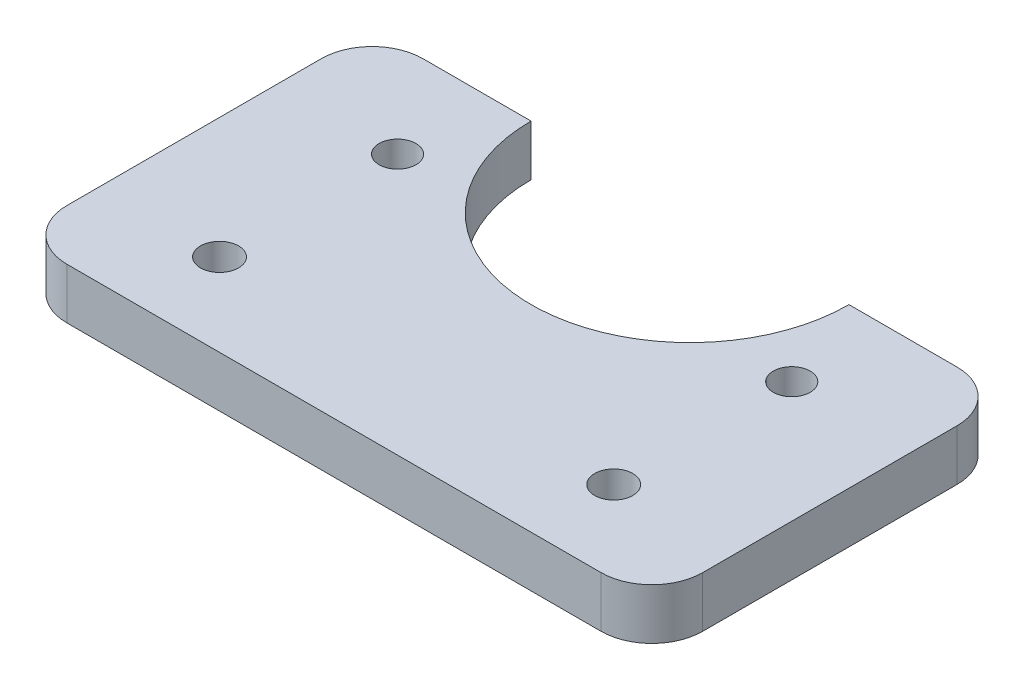
from build123d import *

# Parameters (mm, degrees)
SKETCH_1_W          = 50
SKETCH_1_H          = 25
EXTRUDE_1_DEPTH     = 4
SKETCH_2_R          = 1.45
CUT_EXTRUDE_1_DEPTH = 4
SKETCH_3_R          = 12.5
CUT_EXTRUDE_2_DEPTH = 4
SKETCH_5_W          = 50
SKETCH_5_H          = 4
EXTRUDE_2_DEPTH     = 3
FILLET_1_R          = 4
SKETCH_11_R         = 1.5
CUT_EXTRUDE_4_DEPTH = 10


with BuildPart() as part:
    # 草图1 → 凸台-拉伸1 (new body)
    with BuildSketch(Plane(origin=(0, 0, 0), x_dir=(1, 0, 0), z_dir=(0, 1, 0))):
        Rectangle(SKETCH_1_W, SKETCH_1_H)
    extrude(amount=EXTRUDE_1_DEPTH)

    # 草图2 → 切除-拉伸1 (cut)
    with BuildSketch(Plane(origin=(0, 4, 0), x_dir=(1, 0, 0), z_dir=(0, 1, 0))):
        with Locations((-15.5, 5)):
            Circle(SKETCH_2_R)
        with Locations((15.5, 5)):
            Circle(SKETCH_2_R)
    extrude(amount=-CUT_EXTRUDE_1_DEPTH, mode=Mode.SUBTRACT)

    # 草图3 → 切除-拉伸2 (cut)
    with BuildSketch(Plane(origin=(0, 4, 0), x_dir=(1, 0, 0), z_dir=(0, 1, 0))):
        with Locations((0, 12.5)):
            Circle(SKETCH_3_R)
    extrude(amount=-CUT_EXTRUDE_2_DEPTH, mode=Mode.SUBTRACT)

    # 草图5 → 凸台-拉伸2 (add)
    with BuildSketch(Plane.XY.offset(12.5)):
        with Locations((0, 2)):
            Rectangle(SKETCH_5_W, SKETCH_5_H)
    extrude(amount=EXTRUDE_2_DEPTH)

    # 圆角1
    fillet_1_edges = [part.edges().sort_by_distance(p)[0] for p in [
        (-25, 2, -12.5),
        (25, 2, -12.5),
        (25, 2, 15.5),
        (-25, 2, 15.5),
    ]]
    fillet(fillet_1_edges, radius=FILLET_1_R)

    # 草图11 → 切除-拉伸4 (cut)
    with BuildSketch(Plane(origin=(0, 4, 0), x_dir=(1, 0, 0), z_dir=(0, 1, 0))):
        with Locations((-15.5, -9)):
            Circle(SKETCH_11_R)
        with Locations((15.5, -9)):
            Circle(SKETCH_11_R)
    extrude(amount=-CUT_EXTRUDE_4_DEPTH, mode=Mode.SUBTRACT)


solid = part.part
